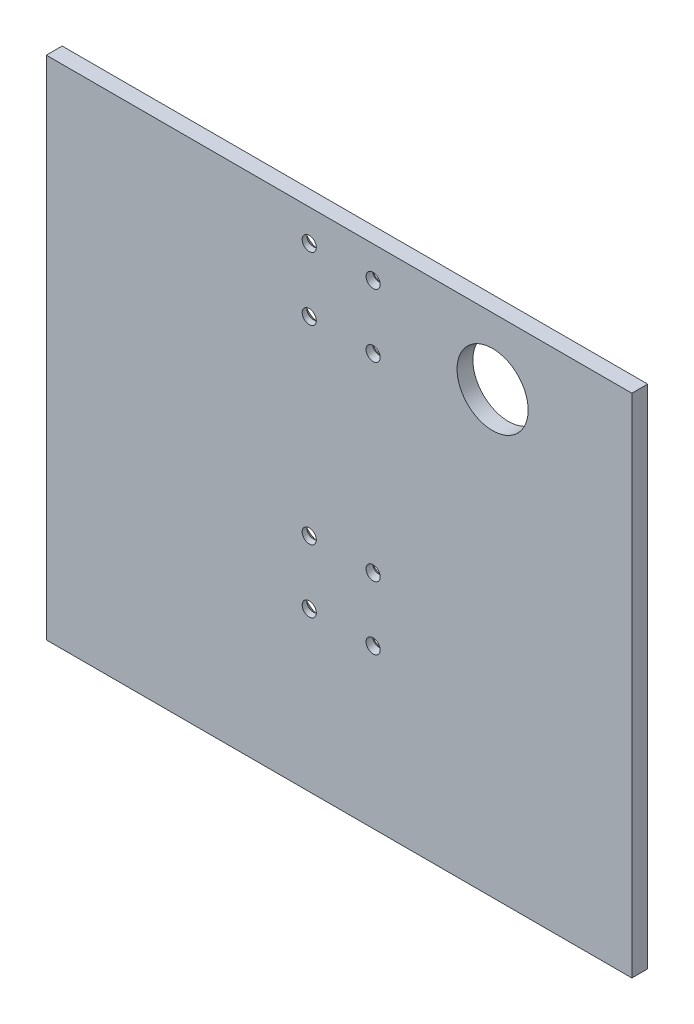
from build123d import *

# Parameters (mm, degrees)
SKETCH1_W                                          = 234.95
SKETCH1_H                                          = 203.2
BOSS_EXTRUDE1_DEPTH                                = 6.35
SKETCH2_R                                          = 14.2748
CUT_EXTRUDE1_DEPTH                                 = 156.445354144
CSK_FOR_10_FLAT_HEAD_MACHINE_SCREW_100_D           = 5.6134
CSK_FOR_10_FLAT_HEAD_MACHINE_SCREW_100_CSINK_D     = 17.78
CSK_FOR_10_FLAT_HEAD_MACHINE_SCREW_100_CSINK_ANGLE = 90
CSK_FOR_10_FLAT_HEAD_MACHINE_SCREW_2_D             = 5.6134
CSK_FOR_10_FLAT_HEAD_MACHINE_SCREW_2_CSINK_D       = 17.78
CSK_FOR_10_FLAT_HEAD_MACHINE_SCREW_2_CSINK_ANGLE   = 90


with BuildPart() as part:
    # Sketch1 → Boss-Extrude1 (new body)
    with BuildSketch(Plane.XY):
        Rectangle(SKETCH1_W, SKETCH1_H)
    extrude(amount=BOSS_EXTRUDE1_DEPTH)

    # Sketch2 → Cut-Extrude1 (cut, through all)
    with BuildSketch(Plane.XY.offset(6.35)):
        with Locations((61.595, 74.93)):
            Circle(SKETCH2_R)
    extrude(amount=-CUT_EXTRUDE1_DEPTH, mode=Mode.SUBTRACT)

    # CSK for _10 Flat Head Machine Screw _100 (through all)
    with Locations(Plane(origin=(292.076985897, -265.595089466, -43.80037576), x_dir=(0.9908610866457157, 0, -0.1348862742137668), z_dir=(-0.1348862742137668, 0, -0.9908610866457157))):
        with Locations((-308.041854918, -227.495089466), (-308.041854918, -252.895089466), (-308.041972913, -329.095089466), (-308.041972913, -354.495089466)):
            CounterSinkHole(CSK_FOR_10_FLAT_HEAD_MACHINE_SCREW_100_D / 2, CSK_FOR_10_FLAT_HEAD_MACHINE_SCREW_100_CSINK_D / 2, counter_sink_angle=CSK_FOR_10_FLAT_HEAD_MACHINE_SCREW_100_CSINK_ANGLE)

    # CSK for _10 Flat Head Machine Screw  2 (through all)
    with Locations(Plane(origin=(292.419597033, -265.595089466, -41.283588599), x_dir=(0.9908610866457157, 0, -0.13488627421376656), z_dir=(-0.13488627421376656, 0, -0.9908610866457157))):
        with Locations((-282.641854918, -227.495089466), (-282.641854918, -252.895089466), (-282.641972913, -329.095089466), (-282.641972913, -354.495089466)):
            CounterSinkHole(CSK_FOR_10_FLAT_HEAD_MACHINE_SCREW_2_D / 2, CSK_FOR_10_FLAT_HEAD_MACHINE_SCREW_2_CSINK_D / 2, counter_sink_angle=CSK_FOR_10_FLAT_HEAD_MACHINE_SCREW_2_CSINK_ANGLE)


solid = part.part
